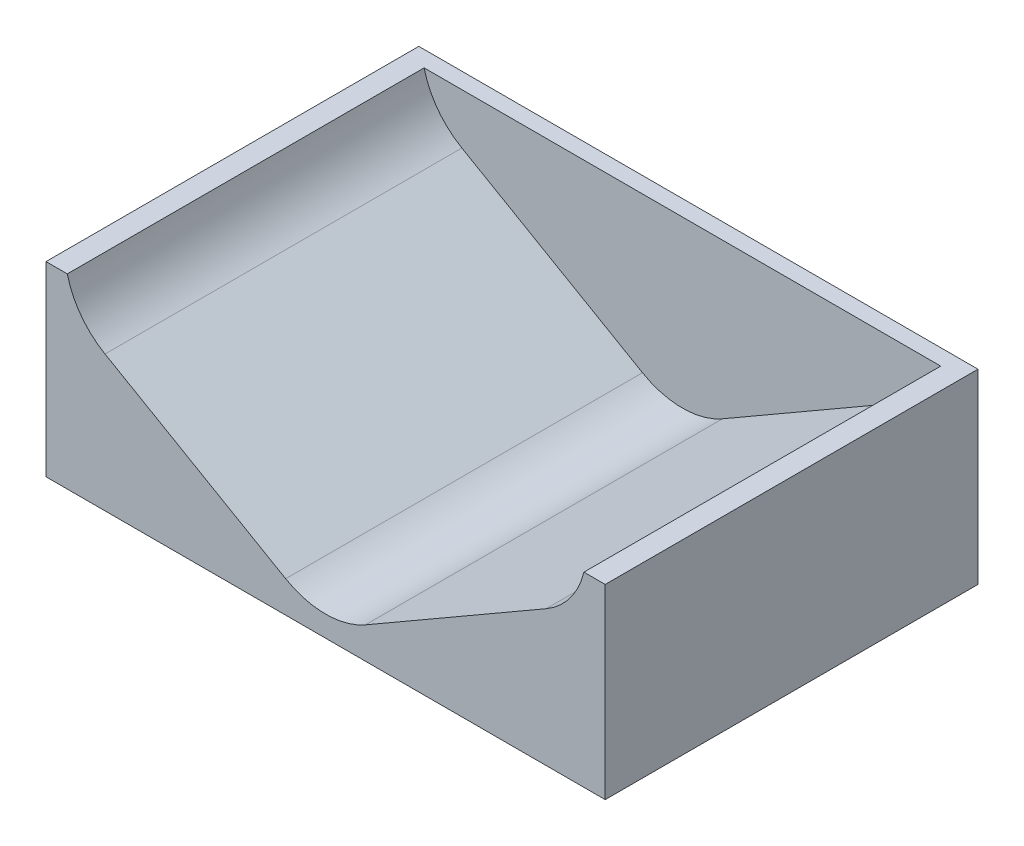
from build123d import *

# Parameters (mm, degrees)
BOSS_EXTRU_1_DEPTH = 70
CONG_1_R           = 15
ESQUISSE2_W        = 105
ESQUISSE2_H        = 35
BOSS_EXTRU_2_DEPTH = 3


with BuildPart() as part:
    # Esquisse1 → Boss.-Extru.1 (new body)
    with BuildSketch(Plane.XY):
        Polygon((0, 0), (48.5, 28.001488056), (48.5, 33.4), (52.5, 33.4), (52.5, -1.6), (-52.5, -1.6), (-52.5, 33.4), (-48.5, 33.4), (-48.5, 28.001488056), align=None)
    extrude(amount=BOSS_EXTRU_1_DEPTH)

    # Congé1
    # the kernel refuses this fillet: 15 mm, written as the material it adds along each edge
    with BuildSketch(Plane(origin=(0, 0, 0), x_dir=(0.866025403784438, 0.5000000000000011, 0), z_dir=(0, 0, 1))) as cong_1_piece_1:
        with BuildLine():
            CenterArc((CONG_1_R * 0.57735026919, CONG_1_R), CONG_1_R, 210, 60)
            Line((-CONG_1_R * 0.288675134595, CONG_1_R * 0.5), (-CONG_1_R * 0.305995642671, CONG_1_R * 0.49))
            Line((-CONG_1_R * 0.305995642671, CONG_1_R * 0.49), (-CONG_1_R * 0.0115470053838, -CONG_1_R * 0.02))
            Line((-CONG_1_R * 0.0115470053838, -CONG_1_R * 0.02), (CONG_1_R * 0.57735026919, -CONG_1_R * 0.02))
            Line((CONG_1_R * 0.57735026919, -CONG_1_R * 0.02), (CONG_1_R * 0.57735026919, 0))
        make_face()
    extrude(amount=70)
    with BuildSketch(Plane(origin=(48.5, 28.001488056, 0), x_dir=(-0.8660254037844379, -0.5000000000000011, 0), z_dir=(0, 0, 1))) as cong_1_piece_2:
        with BuildLine():
            CenterArc((8.181897743, -15), CONG_1_R, 90, 46.502986309)
            Line((-2.699255972, -4.675248486), (-2.916879046, -4.468753456))
            ThreePointArc((-2.916879046, -4.468753456), (-1.609435607, -2.187624243), (-0.259807621, 0.15))
            Line((-0.259807621, 0.15), (0, 0.3))
            Line((0, 0.3), (8.181897743, 0.3))
            Line((8.181897743, 0.3), (8.181897743, 0))
        make_face()
    extrude(amount=70)
    with BuildSketch(Plane(origin=(-48.5, 28.001488056, 0), x_dir=(0, 1, 0), z_dir=(0, 0, 1))) as cong_1_piece_3:
        with BuildLine():
            CenterArc((8.899432185, -14.585731297), CONG_1_R, 103.497013691, 46.502986309)
            Line((-4.090948872, -7.085731297), (-4.350756493, -6.935731297))
            Line((-4.350756493, -6.935731297), (-0.259807621, 0.15))
            Line((-0.259807621, 0.15), (0, 0.3))
            ThreePointArc((0, 0.3), (2.699255972, 0.3), (5.328493539, 0.291714626))
            Line((5.328493539, 0.291714626), (5.398511944, 0))
        make_face()
    extrude(amount=70)

    # Esquisse2 → Boss.-Extru.2 (add)
    with BuildSketch(Plane.XY):
        with Locations((0, 15.9)):
            Rectangle(ESQUISSE2_W, ESQUISSE2_H)
    extrude(amount=BOSS_EXTRU_2_DEPTH)


solid = part.part
